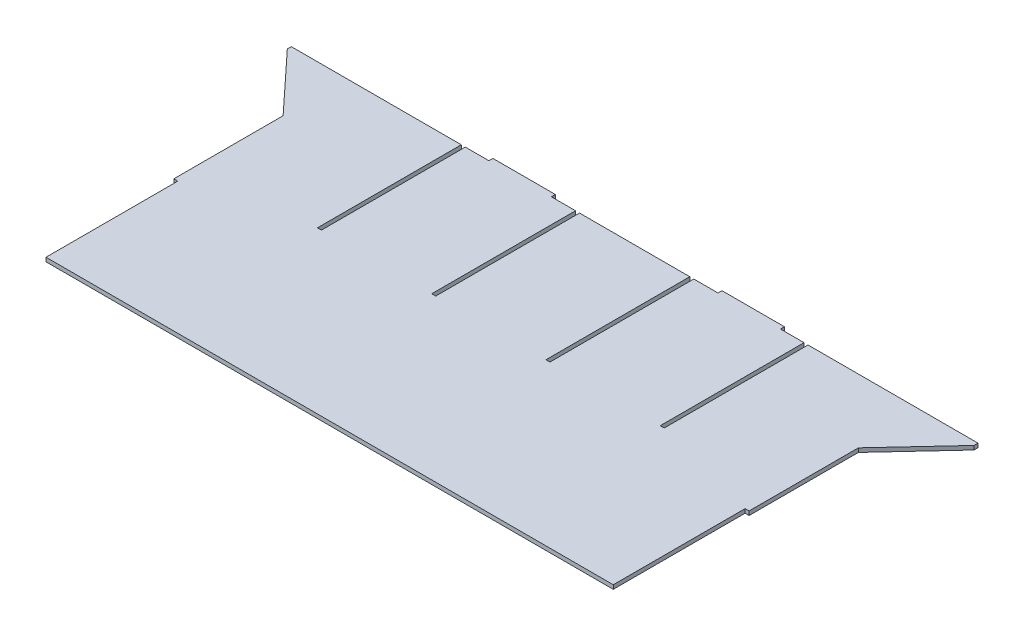
from build123d import *

# Parameters (mm, degrees)
SKETCH1_W           = 457.2020066
SKETCH1_H           = 3.175
BOSS_EXTRUDE1_DEPTH = 242.425000036
SKETCH2_W           = 3.175
SKETCH2_H           = 114.3
CUT_EXTRUDE1_DEPTH  = 334.224218774
LPATTERN1_COUNT     = 4
LPATTERN1_PITCH     = 90.807
SKETCH3_W           = 49.658811606
SKETCH3_H           = 3.175
BOSS_EXTRUDE2_DEPTH = 3.175
BOSS_EXTRUDE3_DEPTH = 3.175
SKETCH5_W           = 3.175
SKETCH5_H           = 104.775
CUT_EXTRUDE2_DEPTH  = 3.175


with BuildPart() as part:
    # Sketch1 → Boss-Extrude1 (new body)
    with BuildSketch(Plane.XY):
        Rectangle(SKETCH1_W, SKETCH1_H)
    extrude(amount=BOSS_EXTRUDE1_DEPTH)

    # Sketch2 → Cut-Extrude1 (cut, through all)
    with BuildSketch(Plane(origin=(0, 1.5875, 0), x_dir=(1, 0, 0), z_dir=(0, 1, 0))):
        with Locations((136.2085033, -57.15)):
            Rectangle(SKETCH2_W, SKETCH2_H)
    cut_extrude1 = extrude(amount=-CUT_EXTRUDE1_DEPTH, mode=Mode.SUBTRACT)

    # LPattern1: Cut-Extrude1 ×4
    with Locations(*[(-i * LPATTERN1_PITCH, 0, 0) for i in range(1, LPATTERN1_COUNT)]):
        add(cut_extrude1, mode=Mode.SUBTRACT)

    # Sketch3 → Boss-Extrude2 (add)
    with BuildSketch(Plane(origin=(0, 0, 0), x_dir=(-1, 0, 0), z_dir=(0, 0, -1))):
        with Locations((-91.020094169, 0)):
            Rectangle(SKETCH3_W, SKETCH3_H)
        with Locations((91.020094169, 0)):
            Rectangle(SKETCH3_W, SKETCH3_H)
    extrude(amount=BOSS_EXTRUDE2_DEPTH)

    # Sketch4 → Boss-Extrude3 (add)
    with BuildSketch(Plane.XZ.offset(1.5875)):
        Polygon((-228.6010033, 0), (-272.8760033, 0), (-272.8760033, 3.175), (-228.6010033, 50.8), align=None)
    boss_extrude3 = extrude(amount=-BOSS_EXTRUDE3_DEPTH)

    # Mirror1: Boss-Extrude3 across plane
    add(boss_extrude3.mirror(Plane(origin=(0, 0, 0), x_dir=(0, 0, 1), z_dir=(1, 0, 0))))

    # Sketch5 → Cut-Extrude2 (cut)
    with BuildSketch(Plane.XZ.offset(1.5875)):
        with Locations((-227.0135033, 190.037500036)):
            Rectangle(SKETCH5_W, SKETCH5_H)
    cut_extrude2 = extrude(amount=-CUT_EXTRUDE2_DEPTH, mode=Mode.SUBTRACT)

    # Mirror2: Cut-Extrude2 across plane
    add(cut_extrude2.mirror(Plane(origin=(0, 0, 0), x_dir=(0, 0, 1), z_dir=(1, 0, 0))), mode=Mode.SUBTRACT)


solid = part.part
